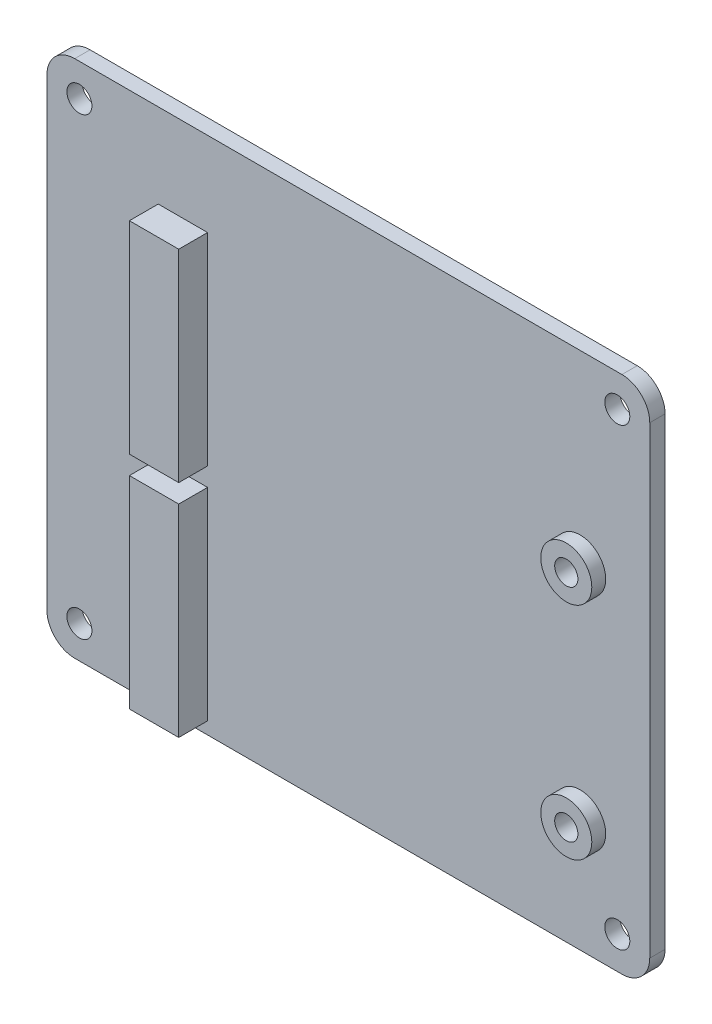
from build123d import *

# Parameters (mm, degrees)
EXTRUDE_1_DEPTH     = 1.65
SKETCH_2_R          = 1.35
CUT_EXTRUDE_1_DEPTH = 1.65
SKETCH_3_W          = 5.32
SKETCH_3_H          = 21.8
EXTRUDE_2_DEPTH     = 3.11
SKETCH_4_R          = 2.75
EXTRUDE_3_DEPTH     = 1.5
CUT_EXTRUDE_2_REACH = 195.46
SKETCH_5_R          = 1.25


with BuildPart() as part:
    # 草图1 → 凸台-拉伸1 (new body)
    with BuildSketch(Plane(origin=(23.590329777, 87.741111173, -201.321110376), x_dir=(1, 0, 0), z_dir=(0, 0, 1))):
        with BuildLine():
            Line((-93.354201199, 91.485679355), (-34.354201199, 91.485679355))
            ThreePointArc((-34.354201199, 91.485679355), (-32.232880856, 90.606999698), (-31.354201199, 88.485679355))
            Line((-31.354201199, 88.485679355), (-31.354201199, 38.485679355))
            ThreePointArc((-31.354201199, 38.485679355), (-32.232880856, 36.364359011), (-34.354201199, 35.485679355))
            Line((-34.354201199, 35.485679355), (-93.354201199, 35.485679355))
            ThreePointArc((-93.354201199, 35.485679355), (-95.475521543, 36.364359011), (-96.354201199, 38.485679355))
            Line((-96.354201199, 38.485679355), (-96.354201199, 88.485679355))
            ThreePointArc((-96.354201199, 88.485679355), (-95.475521543, 90.606999698), (-93.354201199, 91.485679355))
        make_face()
    extrude(amount=EXTRUDE_1_DEPTH)

    # 草图2 → 切除-拉伸1 (cut)
    with BuildSketch(Plane.XY.offset(-199.671110376)):
        with Locations((-69.263871422, 175.726790528)):
            Circle(SKETCH_2_R)
        with Locations((-11.263871422, 175.726790528)):
            Circle(SKETCH_2_R)
        with Locations((-69.263871422, 126.726790528)):
            Circle(SKETCH_2_R)
        with Locations((-11.263871422, 126.726790528)):
            Circle(SKETCH_2_R)
    extrude(amount=-CUT_EXTRUDE_1_DEPTH, mode=Mode.SUBTRACT)

    # 草图3 → 凸台-拉伸2 (add)
    with BuildSketch(Plane.XY.offset(-199.671110376)):
        with Locations((-58.103871422, 159.246790528)):
            Rectangle(SKETCH_3_W, SKETCH_3_H)
        with Locations((-58.103871422, 135.446790528)):
            Rectangle(SKETCH_3_W, SKETCH_3_H)
    extrude(amount=EXTRUDE_2_DEPTH)

    # 草图4 → 凸台-拉伸3 (add)
    with BuildSketch(Plane.XY.offset(-199.671110376)):
        with Locations((-15.263871422, 135.446790528)):
            Circle(SKETCH_4_R)
        with Locations((-15.263871422, 159.246790528)):
            Circle(SKETCH_4_R)
    extrude(amount=EXTRUDE_3_DEPTH)

    # 草图5 → 切除-拉伸2 (cut, up to next)
    with BuildSketch(Plane.XY.offset(-198.171110376), mode=Mode.PRIVATE) as cut_extrude_2_sk1:
        with Locations((-15.263871422, 159.246790528)):
            Circle(SKETCH_5_R)
    cut_extrude_2_tool1 = extrude(cut_extrude_2_sk1.sketch, amount=-CUT_EXTRUDE_2_REACH, mode=Mode.PRIVATE) & part.part
    # 草图5 → 切除-拉伸2 (cut, up to next)
    with BuildSketch(Plane.XY.offset(-198.171110376), mode=Mode.PRIVATE) as cut_extrude_2_sk2:
        with Locations((-15.263871422, 135.446790528)):
            Circle(SKETCH_5_R)
    cut_extrude_2_tool2 = extrude(cut_extrude_2_sk2.sketch, amount=-CUT_EXTRUDE_2_REACH, mode=Mode.PRIVATE) & part.part
    add(cut_extrude_2_tool1.solids().sort_by_distance((-15.263871, 159.246791, -198.17111))[0], mode=Mode.SUBTRACT)
    add(cut_extrude_2_tool2.solids().sort_by_distance((-15.263871, 135.446791, -198.17111))[0], mode=Mode.SUBTRACT)


solid = part.part
